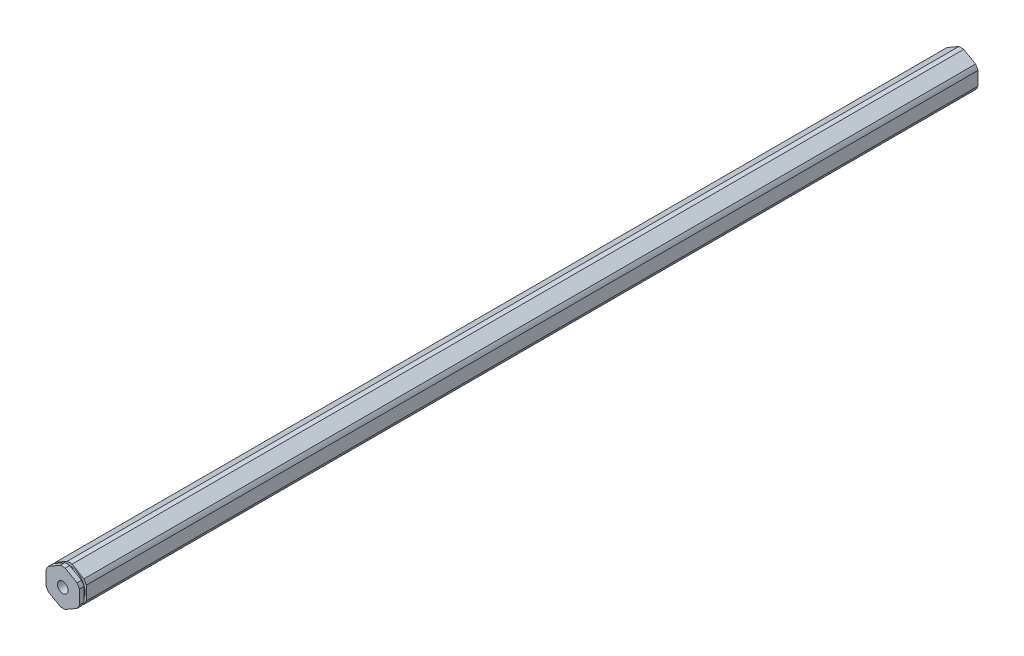
from build123d import *

# Parameters (mm, degrees)
BOSS_EXTRUDE1_DEPTH                  = 170.3705
F_10_32_TAPPED_HOLE1_D               = 4.0386
F_10_32_TAPPED_HOLE1_DEPTH           = 16.34744
F_10_32_TAPPED_HOLE1_TIP             = 1.213317848
F_10_32_TAPPED_HOLE1_ON_FACE_2_D     = 4.0386
F_10_32_TAPPED_HOLE1_ON_FACE_2_DEPTH = 16.34744
F_10_32_TAPPED_HOLE1_ON_FACE_2_TIP   = 1.213317848
SKETCH5_W                            = 0.889
SKETCH5_H                            = 1.0033


with BuildPart() as part:
    # Sketch1 → Boss-Extrude1 (new, symmetric)
    with BuildSketch(Plane.XY):
        with BuildLine():
            ThreePointArc((0.93173274, 6.79441227), (0, 6.858), (-0.93173274, 6.79441227))
            Line((-0.93173274, 6.79441227), (-5.41826726, 4.204110358))
            ThreePointArc((-5.41826726, 4.204110358), (-5.939202219, 3.429), (-6.35, 2.590301913))
            Line((-6.35, 2.590301913), (-6.35, -2.590301913))
            ThreePointArc((-6.35, -2.590301913), (-5.939202219, -3.429), (-5.41826726, -4.204110358))
            Line((-5.41826726, -4.204110358), (-0.93173274, -6.79441227))
            ThreePointArc((-0.93173274, -6.79441227), (0, -6.858), (0.93173274, -6.79441227))
            Line((0.93173274, -6.79441227), (5.41826726, -4.204110358))
            ThreePointArc((5.41826726, -4.204110358), (5.939202219, -3.429), (6.35, -2.590301913))
            Line((6.35, -2.590301913), (6.35, 2.590301913))
            ThreePointArc((6.35, 2.590301913), (5.939202219, 3.429), (5.41826726, 4.204110358))
            Line((5.41826726, 4.204110358), (0.93173274, 6.79441227))
        make_face()
    extrude(amount=BOSS_EXTRUDE1_DEPTH, both=True)

    # #10-32 Tapped Hole1
    with Locations(Plane.XY.offset(170.3705)):
        with Locations((0, 0)):
            Hole(F_10_32_TAPPED_HOLE1_D / 2, depth=F_10_32_TAPPED_HOLE1_DEPTH)
            with Locations((0, 0, -(F_10_32_TAPPED_HOLE1_DEPTH + F_10_32_TAPPED_HOLE1_TIP / 2))):  # 118° drill point
                Cone(0, F_10_32_TAPPED_HOLE1_D / 2, F_10_32_TAPPED_HOLE1_TIP, mode=Mode.SUBTRACT)

    # #10-32 Tapped Hole1 on face 2
    with Locations(Plane(origin=(0, 0, -170.3705), x_dir=(-1, 0, 0), z_dir=(0, 0, -1))):
        with Locations((0, 0)):
            Hole(F_10_32_TAPPED_HOLE1_ON_FACE_2_D / 2, depth=F_10_32_TAPPED_HOLE1_ON_FACE_2_DEPTH)
            with Locations((0, 0, -(F_10_32_TAPPED_HOLE1_ON_FACE_2_DEPTH + F_10_32_TAPPED_HOLE1_ON_FACE_2_TIP / 2))):  # 118° drill point
                Cone(0, F_10_32_TAPPED_HOLE1_ON_FACE_2_D / 2, F_10_32_TAPPED_HOLE1_ON_FACE_2_TIP, mode=Mode.SUBTRACT)

    # Sketch5 → Cut-Revolve1 (revolve, cut)
    with BuildSketch(Plane(origin=(0, 0, 0), x_dir=(0, 0, -1), z_dir=(1, 0, 0))):
        with Locations((-168.2115, 6.35635)):
            Rectangle(SKETCH5_W, SKETCH5_H)
    revolve(axis=Axis((0, 0, 165.047176272), (0, 0, -1)), mode=Mode.SUBTRACT)


solid = part.part
